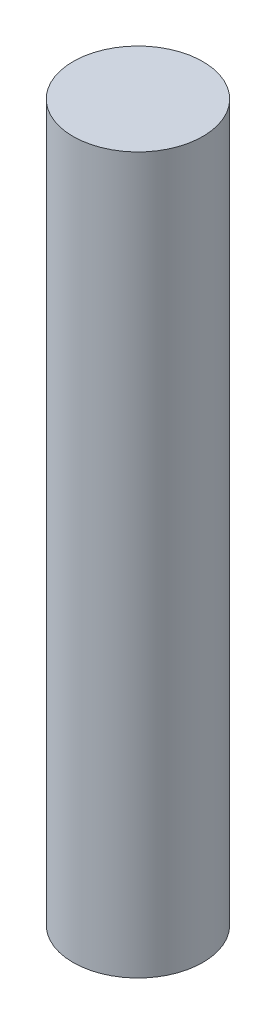
from build123d import *

# Parameters (mm, degrees)
SKETCH1_R           = 6.35
BOSS_EXTRUDE1_DEPTH = 70


with BuildPart() as part:
    # Sketch1 → Boss-Extrude1 (new body)
    with BuildSketch(Plane(origin=(0, 0, 0), x_dir=(1, 0, 0), z_dir=(0, 1, 0))):
        Circle(SKETCH1_R)
    extrude(amount=BOSS_EXTRUDE1_DEPTH)


solid = part.part
